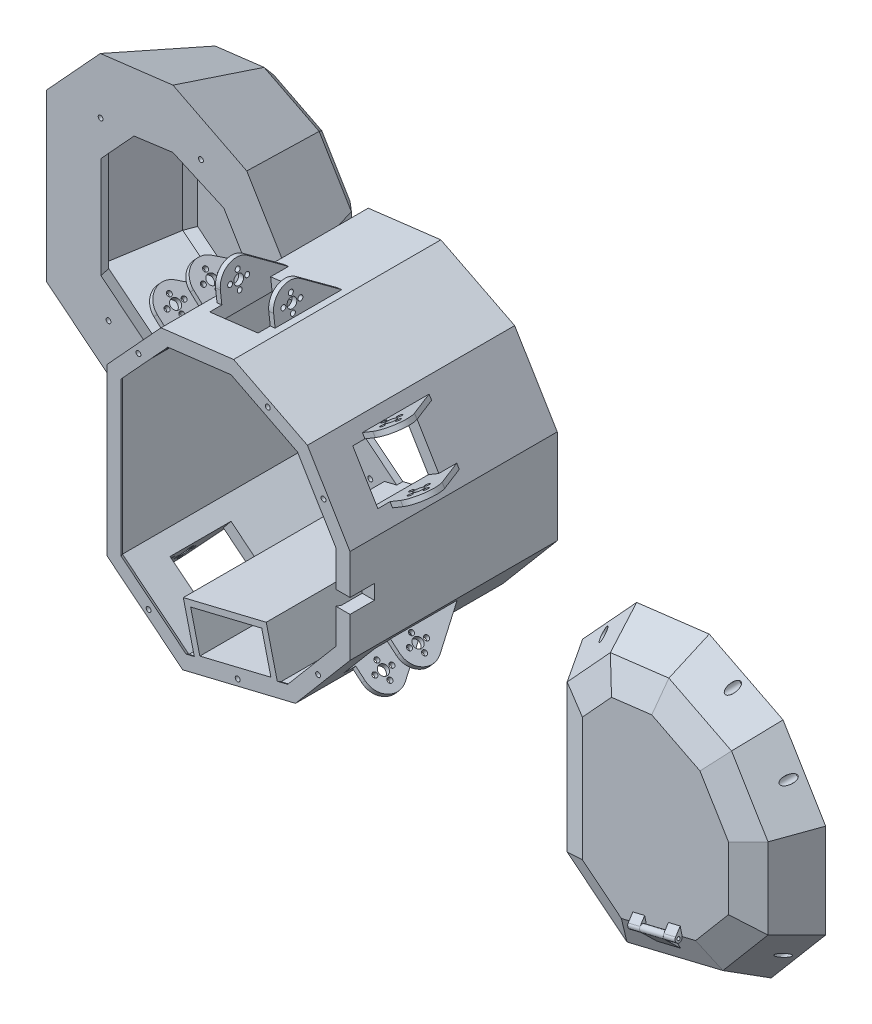
from build123d import *

# Parameters (mm, degrees)
SALIENTE_EXTRUIR1_DEPTH            = 30
SALIENTE_EXTRUIR1_TAPER            = 30
SALIENTE_EXTRUIR2_DEPTH            = 10
SALIENTE_EXTRUIR2_TAPER            = 66
SALIENTE_EXTRUIR3_DEPTH            = 170
SALIENTE_EXTRUIR4_DEPTH            = 80
SALIENTE_EXTRUIR4_TAPER            = 20
SALIENTE_EXTRUIR5_DEPTH            = 10
SALIENTE_EXTRUIR5_TAPER            = 48
VACIADO5_T                         = 10
CROQUIS11_W                        = 4
CROQUIS11_H                        = 54.70402768
SALIENTE_EXTRUIR6_DEPTH            = 40
CROQUIS12_R                        = 4
CROQUIS12_R_2                      = 2
CORTAR_EXTRUIR2_DEPTH              = 50
CROQUIS13_W                        = 4
CROQUIS13_H                        = 54.7
SALIENTE_EXTRUIR7_DEPTH            = 40
CROQUIS14_R                        = 4
CROQUIS14_R_2                      = 2
CORTAR_EXTRUIR3_DEPTH              = 50
CROQUIS15_W                        = 4
CROQUIS15_H                        = 54.70402768
SALIENTE_EXTRUIR8_DEPTH            = 40
CROQUIS18_R                        = 4
CROQUIS18_R_2                      = 2
CORTAR_EXTRUIR4_DEPTH              = 50
CROQUIS19_W                        = 4
CROQUIS19_H                        = 54.70402768
SALIENTE_EXTRUIR9_DEPTH            = 40
CROQUIS20_R                        = 4
CROQUIS20_R_2                      = 2
CORTAR_EXTRUIR5_DEPTH              = 50
CROQUIS21_W                        = 4
CROQUIS21_H                        = 54.70402768
SALIENTE_EXTRUIR10_DEPTH           = 40
CROQUIS22_R                        = 4
CROQUIS22_R_2                      = 2
CORTAR_EXTRUIR6_DEPTH              = 50
CROQUIS23_W                        = 40
CROQUIS23_H                        = 50
CORTAR_EXTRUIR8_DEPTH              = 10
CROQUIS24_W                        = 40
CROQUIS24_H                        = 50
CORTAR_EXTRUIR9_DEPTH              = 10
CROQUIS25_W                        = 40
CROQUIS25_H                        = 50
CORTAR_EXTRUIR10_DEPTH             = 10
CROQUIS26_W                        = 40
CROQUIS26_H                        = 50
CORTAR_EXTRUIR11_DEPTH             = 10
CROQUIS27_W                        = 40
CROQUIS27_H                        = 50
CORTAR_EXTRUIR12_DEPTH             = 10
CROQUIS28_R                        = 2
CORTAR_EXTRUIR13_DEPTH             = 10
CROQUIS28_3_R                      = 3
CORTAR_EXTRUIR14_DEPTH             = 15
PARTIR3_SURFACE_1_BACK             = 467.561
PARTIR3_SURFACE_1_DEPTH            = 935.122
PARTIR3_SURFACE_2_BACK             = 467.561
PARTIR3_SURFACE_2_DEPTH            = 935.122
SALIENTE_EXTRUIR11_DEPTH           = 5
SALIENTE_EXTRUIR11_OTHER_WAY_DEPTH = 10
SALIENTE_EXTRUIR11_OTHER_WAY_TAPER = 20
CROQUIS30_R                        = 2
CORTAR_EXTRUIR15_DEPTH             = 15
CROQUIS31_W                        = 12
CROQUIS31_H                        = 20
CORTAR_EXTRUIR16_DEPTH             = 15
CROQUIS40_W                        = 70
CROQUIS40_H                        = 170
SALIENTE_EXTRUIR14_DEPTH           = 40
CORTAR_EXTRUIR18_DEPTH             = 165
SALIENTE_EXTRUIR16_DEPTH           = 5
SALIENTE_EXTRUIR17_START           = -10
SALIENTE_EXTRUIR17_OUTLINE_R       = 1.25
SALIENTE_EXTRUIR17_DEPTH           = 20
SALIENTE_EXTRUIR18_START           = 10
CROQUIS51_3_R                      = 2.75
CROQUIS51_3_R_2                    = 1.25
SALIENTE_EXTRUIR18_DEPTH           = 10


# Read off the part's stored shape, not the designer's step: Saliente-Extruir17
with BuildPart() as part:
    # Croquis1 → Saliente-Extruir1 (new body)
    with BuildSketch(Plane(origin=(0, 0, 0), x_dir=(0, 1, 0), z_dir=(0, 0, 1))):
        Polygon((-68.404999243, 107.526749938), (-118.347734244, 45.396375895), (-95.921917701, -47.140641889), (-43.036623179, -91.84289375), (34.322441325, -91.84289375), (92.312520813, -56.905794058), (122.98573872, 3.65316538), (115.706819689, 63.210006613), (67.462083044, 107.526749938), align=None)
    extrude(amount=SALIENTE_EXTRUIR1_DEPTH, taper=SALIENTE_EXTRUIR1_TAPER)

    # Croquis2 → Saliente-Extruir2 (add)
    with BuildSketch(Plane.XY.offset(30)):
        Polygon((-90.206241862, -60.105218731), (-41.189858589, -99.50643397), (37.564034231, -80.420878862), (74.522385675, -36.697056913), (74.522385675, 29.508038933), (44.638667534, 79.110301447), (-6.780395449, 105.154145959), (-54.772569618, 99.288637603), (-90.206241862, 60.71431879), align=None)
    extrude(amount=SALIENTE_EXTRUIR2_DEPTH, taper=SALIENTE_EXTRUIR2_TAPER)

    # Croquis3 → Saliente-Extruir3 (add)
    with BuildSketch(Plane(origin=(0, 0, 0), x_dir=(1, 0, 0), z_dir=(0, 0, -1))):
        Polygon((-45.396375895, 118.347734244), (-107.526749938, 68.404999243), (-107.526749938, -67.462083044), (-63.210006613, -115.706819689), (-3.65316538, -122.98573872), (56.905794058, -92.312520813), (91.84289375, -34.322441325), (91.84289375, 43.036623179), (47.140641889, 95.921917701), align=None)
    extrude(amount=SALIENTE_EXTRUIR3_DEPTH)

    # Croquis4 → Saliente-Extruir4 (add)
    with BuildSketch(Plane(origin=(0, 0, -170), x_dir=(1, 0, 0), z_dir=(0, 0, -1))):
        Polygon((47.140641889, 95.921917701), (-45.396375895, 118.347734244), (-107.526749938, 68.404999243), (-107.526749938, -67.462083044), (-63.210006613, -115.706819689), (-3.65316538, -122.98573872), (56.905794058, -92.312520813), (91.84289375, -34.322441325), (91.84289375, 43.036623179), align=None)
    extrude(amount=SALIENTE_EXTRUIR4_DEPTH, taper=SALIENTE_EXTRUIR4_TAPER)

    # Croquis5 → Saliente-Extruir5 (add)
    with BuildSketch(Plane(origin=(0, 0, -250), x_dir=(1, 0, 0), z_dir=(0, 0, -1))):
        Polygon((62.725275009, 32.37913711), (31.041344489, 69.863020524), (-38.324772302, 86.673501851), (-78.409131197, 54.452184261), (-78.409131197, -56.118372683), (-49.025776422, -88.106107036), (-8.910372182, -93.008932192), (36.2834479, -70.118183997), (62.725275009, -26.228918162), align=None)
    extrude(amount=SALIENTE_EXTRUIR5_DEPTH, taper=SALIENTE_EXTRUIR5_TAPER)

    # Vaciado5 (no face opened: a closed hollow body)
    add(offset(amount=-VACIADO5_T, mode=Mode.PRIVATE), mode=Mode.SUBTRACT)

    # Croquis11 → Saliente-Extruir6 (add)
    with BuildSketch(Plane(origin=(-91.928010464, 84.44340932, 0), x_dir=(-0.676490722691871, -0.7364511539211749, 0), z_dir=(-0.7364511539211749, 0.676490722691871, 0))):
        with Locations((-31.696558975, -67.35201384)):
            Rectangle(CROQUIS11_W, CROQUIS11_H)
        with Locations((12.303441025, -67.35201384)):
            Rectangle(CROQUIS11_W, CROQUIS11_H)
    extrude(amount=SALIENTE_EXTRUIR6_DEPTH)

    # Croquis12 → Cortar-Extruir2 (cut)
    with BuildSketch(Plane(origin=(22.795409533, 24.815869741, 0), x_dir=(-0.7364511539211749, 0.676490722691871, 0), z_dir=(0.676490722691871, 0.7364511539211749, 0))):
        with Locations((134.825672382, -55)):
            Circle(CROQUIS12_R)
        with Locations((141.825672382, -55)):
            Circle(CROQUIS12_R_2)
        with Locations((134.825672382, -62)):
            Circle(CROQUIS12_R_2)
        with Locations((127.825672382, -55)):
            Circle(CROQUIS12_R_2)
        with Locations((134.825672382, -48)):
            Circle(CROQUIS12_R_2)
        with BuildLine():
            Line((124.825672382, -94.70402768), (147.017969868, -63.737727509))
            ThreePointArc((147.017969868, -63.737727509), (148.168571479, -48.146749407), (134.825672382, -40))
            Line((134.825672382, -40), (164.945824862, -1.18926273))
            Line((164.945824862, -1.18926273), (173.837004067, -6.387014225))
            Line((173.837004067, -6.387014225), (164.825672382, -94.70402768))
            Line((164.825672382, -94.70402768), (124.825672382, -94.70402768))
        make_face()
    extrude(amount=-CORTAR_EXTRUIR2_DEPTH, mode=Mode.SUBTRACT)

    # Croquis13 → Saliente-Extruir7 (add)
    with BuildSketch(Plane(origin=(-14.863619809, 121.615619211, 0), x_dir=(-0.9926140205620685, -0.12131531718462249, 0), z_dir=(-0.12131531718462249, 0.9926140205620685, 0))):
        with Locations((-3.293870727, -67.35)):
            Rectangle(CROQUIS13_W, CROQUIS13_H)
        with Locations((40.706129273, -67.35)):
            Rectangle(CROQUIS13_W, CROQUIS13_H)
    extrude(amount=SALIENTE_EXTRUIR7_DEPTH)

    # Croquis14 → Cortar-Extruir3 (cut)
    with BuildSketch(Plane(origin=(5.254770306, 0.642227606, 0), x_dir=(-0.12131531718462255, 0.9926140205620686, 0), z_dir=(0.9926140205620686, 0.12131531718462255, 0))):
        with Locations((132.5205535, -55)):
            Circle(CROQUIS14_R)
        with Locations((132.5205535, -48)):
            Circle(CROQUIS14_R_2)
        with Locations((139.5205535, -55)):
            Circle(CROQUIS14_R_2)
        with Locations((132.5205535, -62)):
            Circle(CROQUIS14_R_2)
        with Locations((125.5205535, -55)):
            Circle(CROQUIS14_R_2)
        with BuildLine():
            Line((122.5205535, -94.7), (144.712312806, -63.738478415))
            ThreePointArc((144.712312806, -63.738478415), (145.863663636, -48.147160305), (132.5205535, -40))
            Line((132.5205535, -40), (156.981323368, -5.368634874))
            Line((156.981323368, -5.368634874), (189.618535001, -23.570885668))
            Line((189.618535001, -23.570885668), (165.331077015, -94.7))
            Line((165.331077015, -94.7), (122.5205535, -94.7))
        make_face()
    extrude(amount=-CORTAR_EXTRUIR3_DEPTH, mode=Mode.SUBTRACT)

    # Croquis15 → Saliente-Extruir8 (add)
    with BuildSketch(Plane(origin=(82.555986417, 49.737243905, 0), x_dir=(-0.5160485808412013, 0.8565593162249665, 0), z_dir=(0.8565593162249665, 0.5160485808412013, 0))):
        with Locations((-6.145596333, -67.35201384)):
            Rectangle(CROQUIS15_W, CROQUIS15_H)
        with Locations((37.854403667, -67.35201384)):
            Rectangle(CROQUIS15_W, CROQUIS15_H)
    extrude(amount=SALIENTE_EXTRUIR8_DEPTH)

    # Croquis18 → Cortar-Extruir4 (cut)
    with BuildSketch(Plane(origin=(4.203523428, -6.977186425, 0), x_dir=(0.8565593162249665, 0.5160485808412013, 0), z_dir=(0.5160485808412013, -0.8565593162249665, 0))):
        with Locations((106.380933408, -55)):
            Circle(CROQUIS18_R)
        with Locations((106.380933408, -48)):
            Circle(CROQUIS18_R_2)
        with Locations((113.380933408, -55)):
            Circle(CROQUIS18_R_2)
        with Locations((106.380933408, -62)):
            Circle(CROQUIS18_R_2)
        with Locations((99.380933408, -55)):
            Circle(CROQUIS18_R_2)
        with BuildLine():
            Line((96.380933408, -94.70402768), (118.573230893, -63.737727509))
            ThreePointArc((118.573230893, -63.737727509), (119.723832505, -48.146749407), (106.380933408, -40))
            Line((106.380933408, -40), (134.708061578, -5.869404832))
            Line((134.708061578, -5.869404832), (160.9211633, -21.571733922))
            Line((160.9211633, -21.571733922), (143.734603356, -94.70402768))
            Line((143.734603356, -94.70402768), (96.380933408, -94.70402768))
        make_face()
    extrude(amount=-CORTAR_EXTRUIR4_DEPTH, mode=Mode.SUBTRACT)

    # Croquis19 → Saliente-Extruir9 (add)
    with BuildSketch(Plane(origin=(74.78682567, -63.214917252, 0), x_dir=(0.6455479366889291, 0.7637197532057597, 0), z_dir=(0.7637197532057597, -0.6455479366889291, 0))):
        with Locations((-30.202423941, -67.35201384)):
            Rectangle(CROQUIS19_W, CROQUIS19_H)
        with Locations((13.797576059, -67.35201384)):
            Rectangle(CROQUIS19_W, CROQUIS19_H)
    extrude(amount=SALIENTE_EXTRUIR9_DEPTH)

    # Croquis20 → Cortar-Extruir5 (cut)
    with BuildSketch(Plane(origin=(-20.788208331, -24.593627264, 0), x_dir=(0.7637197532057597, -0.645547936688929, 0), z_dir=(-0.645547936688929, -0.7637197532057597, 0))):
        with Locations((107.924435444, -55)):
            Circle(CROQUIS20_R)
        with Locations((107.924435444, -48)):
            Circle(CROQUIS20_R_2)
        with Locations((114.924435444, -55)):
            Circle(CROQUIS20_R_2)
        with Locations((107.924435444, -62)):
            Circle(CROQUIS20_R_2)
        with Locations((100.924435444, -55)):
            Circle(CROQUIS20_R_2)
        with BuildLine():
            Line((97.924435444, -94.70402768), (120.11673293, -63.737727509))
            ThreePointArc((120.11673293, -63.737727509), (121.267334541, -48.146749407), (107.924435444, -40))
            Line((107.924435444, -40), (137.968823498, -8.626915468))
            Line((137.968823498, -8.626915468), (166.338745199, -32.579485082))
            Line((166.338745199, -32.579485082), (145.364960685, -94.70402768))
            Line((145.364960685, -94.70402768), (97.924435444, -94.70402768))
        make_face()
    extrude(amount=-CORTAR_EXTRUIR5_DEPTH, mode=Mode.SUBTRACT)

    # Croquis21 → Saliente-Extruir10 (add)
    with BuildSketch(Plane(origin=(-75.609807157, -94.061040107, 0), x_dir=(0.7794076024949522, -0.6265171898464325, 0), z_dir=(-0.6265171898464325, -0.7794076024949522, 0))):
        with Locations((-23.092824546, -67.35201384)):
            Rectangle(CROQUIS21_W, CROQUIS21_H)
        with Locations((20.907175454, -67.35201384)):
            Rectangle(CROQUIS21_W, CROQUIS21_H)
    extrude(amount=SALIENTE_EXTRUIR10_DEPTH)

    # Croquis22 → Cortar-Extruir6 (cut)
    with BuildSketch(Plane(origin=(-19.557538219, 15.72108592, 0), x_dir=(-0.6265171898464322, -0.7794076024949523, 0), z_dir=(-0.7794076024949523, 0.6265171898464322, 0))):
        with Locations((130.682733663, -55)):
            Circle(CROQUIS22_R)
        with Locations((130.682733663, -48)):
            Circle(CROQUIS22_R_2)
        with Locations((137.682733663, -55)):
            Circle(CROQUIS22_R_2)
        with Locations((130.682733663, -62)):
            Circle(CROQUIS22_R_2)
        with Locations((123.682733663, -55)):
            Circle(CROQUIS22_R_2)
        with BuildLine():
            Line((120.682733663, -94.70402768), (142.875031149, -63.737727509))
            ThreePointArc((142.875031149, -63.737727509), (144.02563276, -48.146749407), (130.682733663, -40))
            Line((130.682733663, -40), (155.208064132, -5.904154912))
            Line((155.208064132, -5.904154912), (193.900860848, -26.783087829))
            Line((193.900860848, -26.783087829), (171.143323285, -94.70402768))
            Line((171.143323285, -94.70402768), (120.682733663, -94.70402768))
        make_face()
    extrude(amount=-CORTAR_EXTRUIR6_DEPTH, mode=Mode.SUBTRACT)

    # Croquis23 → Cortar-Extruir8 (cut)
    with BuildSketch(Plane(origin=(-75.609807157, -94.061040107, 0), x_dir=(0.7794076024949522, -0.6265171898464325, 0), z_dir=(-0.6265171898464325, -0.7794076024949522, 0))):
        with Locations((-1.092824546, -55)):
            Rectangle(CROQUIS23_W, CROQUIS23_H)
    extrude(amount=-CORTAR_EXTRUIR8_DEPTH, mode=Mode.SUBTRACT)

    # Croquis24 → Cortar-Extruir9 (cut)
    with BuildSketch(Plane(origin=(74.78682567, -63.214917252, 0), x_dir=(0.6455479366889291, 0.7637197532057597, 0), z_dir=(0.7637197532057597, -0.6455479366889291, 0))):
        with Locations((-8.202423941, -55)):
            Rectangle(CROQUIS24_W, CROQUIS24_H)
    extrude(amount=-CORTAR_EXTRUIR9_DEPTH, mode=Mode.SUBTRACT)

    # Croquis25 → Cortar-Extruir10 (cut)
    with BuildSketch(Plane(origin=(82.555986417, 49.737243905, 0), x_dir=(-0.5160485808412013, 0.8565593162249665, 0), z_dir=(0.8565593162249665, 0.5160485808412013, 0))):
        with Locations((15.854403667, -55)):
            Rectangle(CROQUIS25_W, CROQUIS25_H)
    extrude(amount=-CORTAR_EXTRUIR10_DEPTH, mode=Mode.SUBTRACT)

    # Croquis26 → Cortar-Extruir11 (cut)
    with BuildSketch(Plane(origin=(-14.863619809, 121.615619211, 0), x_dir=(-0.9926140205620685, -0.12131531718462249, 0), z_dir=(-0.12131531718462249, 0.9926140205620685, 0))):
        with Locations((18.706129273, -55)):
            Rectangle(CROQUIS26_W, CROQUIS26_H)
    extrude(amount=-CORTAR_EXTRUIR11_DEPTH, mode=Mode.SUBTRACT)

    # Croquis27 → Cortar-Extruir12 (cut)
    with BuildSketch(Plane(origin=(-91.928010464, 84.44340932, 0), x_dir=(-0.676490722691871, -0.7364511539211749, 0), z_dir=(-0.7364511539211749, 0.676490722691871, 0))):
        with Locations((-9.696558975, -55)):
            Rectangle(CROQUIS27_W, CROQUIS27_H)
    extrude(amount=-CORTAR_EXTRUIR12_DEPTH, mode=Mode.SUBTRACT)

    # Croquis28 → Cortar-Extruir13 (cut)
    with BuildSketch(Plane(origin=(0, 0, 0), x_dir=(0, 1, 0), z_dir=(0, 0, 1))):
        with Locations(Location((-66.251530756, -65.673169054, 0), (0, 0, 270))):
            Circle(CROQUIS28_R)
        with Locations(Location((60.737238165, -70.091547323, 0), (0, 0, 270))):
            Circle(CROQUIS28_R)
        with Locations(Location((-102.275486484, 0.305500111, 0), (0, 0, 270))):
            Circle(CROQUIS28_R)
        with Locations(Location((-89.479328731, 73.328976967, 0), (0, 0, 270))):
            Circle(CROQUIS28_R)
        with Locations(Location((103.188654321, -24.367075796, 0), (0, 0, 270))):
            Circle(CROQUIS28_R)
        with Locations(Location((88.201997753, 81.686122506, 0), (0, 0, 270))):
            Circle(CROQUIS28_R)
    extrude(amount=-CORTAR_EXTRUIR13_DEPTH, mode=Mode.SUBTRACT)

    # Croquis28<3> → Cortar-Extruir14 (cut)
    with BuildSketch(Plane(origin=(0, 0, 0), x_dir=(0, 1, 0), z_dir=(0, 0, 1))):
        with Locations(Location((-102.275486484, 0.305500111, 0), (0, 0, 193.622667342))):
            Circle(CROQUIS28_3_R)
        with Locations(Location((88.201997753, 81.686122506, 0), (0, 0, 47.429979359))):
            Circle(CROQUIS28_3_R)
        with Locations(Location((103.188654321, -24.367075796, 0), (0, 0, 333.137707041))):
            Circle(CROQUIS28_3_R)
        with Locations(Location((60.737238165, -70.091547323, 0), (0, 0, 301.067569375))):
            Circle(CROQUIS28_3_R)
        with Locations(Location((-66.251530756, -65.673169054, 0), (0, 0, 229.793229681))):
            Circle(CROQUIS28_3_R)
        with Locations(Location((-89.479328731, 73.328976967, 0), (0, 0, 141.206368002))):
            Circle(CROQUIS28_3_R)
    extrude(amount=CORTAR_EXTRUIR14_DEPTH, mode=Mode.SUBTRACT)


with BuildPart() as body_2:
    # Partir1: the piece on the far side of the plane
    add(part.part)
    split(bisect_by=Plane.XY, keep=Keep.BOTTOM)

    # Croquis29 → Saliente-Extruir11 (add)
    with BuildSketch(Plane(origin=(0, 0, -170), x_dir=(0, 1, 0), z_dir=(0, 0, 1))):
        Polygon((-118.347734244, 45.396375895), (-95.921917701, -47.140641889), (-43.036623179, -91.84289375), (34.322441325, -91.84289375), (92.312520813, -56.905794058), (122.98573872, 3.65316538), (115.706819689, 63.210006613), (67.462083044, 107.526749938), (-68.404999243, 107.526749938), align=None)
        Polygon((56.552163909, -38.015372281), (75.161525593, 3.723486513), (70.883895, 35.569536763), (41.328378256, 62.71870039), (-41.906024181, 62.71870039), (-72.501762559, 24.656614493), (-58.763339626, -32.033079942), (-26.364941036, -59.41841242), (21.026490345, -59.41841242), align=None, mode=Mode.SUBTRACT)
    extrude(amount=SALIENTE_EXTRUIR11_DEPTH)

    # Croquis29 → Saliente-Extruir11 other way (add)
    with BuildSketch(Plane(origin=(0, 0, -170), x_dir=(0, 1, 0), z_dir=(0, 0, 1))):
        Polygon((-118.347734244, 45.396375895), (-95.921917701, -47.140641889), (-43.036623179, -91.84289375), (34.322441325, -91.84289375), (92.312520813, -56.905794058), (122.98573872, 3.65316538), (115.706819689, 63.210006613), (67.462083044, 107.526749938), (-68.404999243, 107.526749938), align=None)
        Polygon((56.552163909, -38.015372281), (75.161525593, 3.723486513), (70.883895, 35.569536763), (41.328378256, 62.71870039), (-41.906024181, 62.71870039), (-72.501762559, 24.656614493), (-58.763339626, -32.033079942), (-26.364941036, -59.41841242), (21.026490345, -59.41841242), align=None, mode=Mode.SUBTRACT)
    extrude(amount=-SALIENTE_EXTRUIR11_OTHER_WAY_DEPTH, taper=SALIENTE_EXTRUIR11_OTHER_WAY_TAPER)

    # Croquis30 → Cortar-Extruir15 (cut)
    with BuildSketch(Plane.XY.offset(-165)):
        with Locations((-62.963257581, 69.984302941)):
            Circle(CROQUIS30_R)
        with Locations((-56.486772615, -70.766616592)):
            Circle(CROQUIS30_R)
        with Locations((19.320402513, 81.580685238)):
            Circle(CROQUIS30_R)
        with Locations((53.125904378, -52.381604535)):
            Circle(CROQUIS30_R)
    extrude(amount=-CORTAR_EXTRUIR15_DEPTH, mode=Mode.SUBTRACT)


with BuildPart() as part_1:
    add(part.part)

    # Partir1
    split(bisect_by=Plane.XY, keep=Keep.TOP)


with BuildPart() as body_3:
    # Partir3: the piece behind the surface
    add(part_1.part)
    # Partir3 surface: a surface, the sketch's curves swept straight by 935.122 mm
    with BuildLine(Plane.XY.offset(40).offset(-PARTIR3_SURFACE_1_BACK), mode=Mode.PRIVATE) as partir3_surface_1_path:
        Line((-45.396375895, -118.347734244), (-35.735057541, -75.073979046))
        Line((-35.735057541, -75.073979046), (25.145568863, -60.319907741))
        Line((25.145568863, -60.319907741), (47.140641889, -95.921917701))
    partir3_surface_1 = Shell.extrude(partir3_surface_1_path.wire(), (0 * PARTIR3_SURFACE_1_DEPTH, 0 * PARTIR3_SURFACE_1_DEPTH, 1 * PARTIR3_SURFACE_1_DEPTH))
    split(bisect_by=partir3_surface_1, keep=Keep.BOTTOM)


with BuildPart() as part_2:
    add(part_1.part)

    # Partir3: split by a surface, the side it looks to stays
    # Partir3 surface: a surface, the sketch's curves swept straight by 935.122 mm
    with BuildLine(Plane.XY.offset(40).offset(-PARTIR3_SURFACE_2_BACK), mode=Mode.PRIVATE) as partir3_surface_2_path:
        Line((-45.396375895, -118.347734244), (-35.735057541, -75.073979046))
        Line((-35.735057541, -75.073979046), (25.145568863, -60.319907741))
        Line((25.145568863, -60.319907741), (47.140641889, -95.921917701))
    partir3_surface_2 = Shell.extrude(partir3_surface_2_path.wire(), (0 * PARTIR3_SURFACE_2_DEPTH, 0 * PARTIR3_SURFACE_2_DEPTH, 1 * PARTIR3_SURFACE_2_DEPTH))
    split(bisect_by=partir3_surface_2, keep=Keep.TOP)


with BuildPart() as body_4:
    # Partir2: the piece on the far side of the plane
    add(body_2.part)
    split(bisect_by=Plane.XY.offset(-170), keep=Keep.BOTTOM)


with BuildPart() as body_2_1:
    add(body_2.part)

    # Partir2
    split(bisect_by=Plane.XY.offset(-170), keep=Keep.TOP)

    # Croquis31 → Cortar-Extruir16 (cut)
    with BuildSketch(Plane.YZ.offset(91.84289375)):
        with Locations((-4.357090927, -10)):
            Rectangle(CROQUIS31_W, CROQUIS31_H)
    extrude(amount=-CORTAR_EXTRUIR16_DEPTH, mode=Mode.SUBTRACT)

    # Croquis40 → Saliente-Extruir14 (add)
    with BuildSketch(Plane(origin=(22.216356803, -91.672711253, 0), x_dir=(-0.9718678976535764, -0.23552662165967087, 0), z_dir=(-0.23552662165967087, 0.9718678976535764, 0))):
        with Locations((24.385505561, -85)):
            Rectangle(CROQUIS40_W, CROQUIS40_H)
    extrude(amount=SALIENTE_EXTRUIR14_DEPTH)

    # Croquis41 → Cortar-Extruir18 (cut)
    with BuildSketch(Plane.XY):
        Polygon((-38.882601907, -70.466569228), (19.429471952, -56.334971928), (26.966323845, -87.434744653), (-31.345750014, -101.566341952), align=None)
    extrude(amount=-CORTAR_EXTRUIR18_DEPTH, mode=Mode.SUBTRACT)

    # Croquis43 → Saliente-Extruir16 (add)
    with BuildSketch(Plane.XY.offset(-165)):
        Polygon((-44.919574504, -66.784862848), (23.111178332, -50.297999331), (26.463811786, -64.132175712), (-42.240420441, -77.840020045), align=None)
    extrude(amount=-SALIENTE_EXTRUIR16_DEPTH)


with BuildPart() as body_4_1:
    # Sólido-Mover/Copiar3: moved
    add(body_4.part.moved(Location((-219.746064596, 0, 0))))


with BuildPart() as part_3:
    # Sólido-Mover/Copiar4: moved
    add(part_2.part.moved(Location((390.178766484, 0, 0))))

    # Croquis51<3> → Saliente-Extruir18 (add)
    # profile 1 of 2: a face of its own
    with BuildSketch(Plane(origin=(348.037549828, 84.344907903, 0), x_dir=(-0.23552662165967037, 0.9718678976535765, 0), z_dir=(0.9718678976535765, 0.23552662165967037, 0)).offset(SALIENTE_EXTRUIR18_START)):
        with BuildLine():
            Line((-156.44291952, 40), (-149.553832224, 40))
            Line((-149.553832224, 40), (-154.498375872, 44.944543648))
            ThreePointArc((-154.498375872, 44.944543648), (-153.902250806, 44.052379439), (-153.69291952, 43))
            ThreePointArc((-153.69291952, 43), (-154.498375872, 41.055456352), (-156.44291952, 40.25))
            Line((-156.44291952, 40.25), (-156.44291952, 40))
        make_face()
    # profile 2 of 2: a face of its own
    with BuildSketch(Plane(origin=(348.037549828, 84.344907903, 0), x_dir=(-0.23552662165967037, 0.9718678976535765, 0), z_dir=(0.9718678976535765, 0.23552662165967037, 0)).offset(SALIENTE_EXTRUIR18_START)):
        with Locations((-156.44291952, 43)):
            Circle(CROQUIS51_3_R)
        with Locations((-156.44291952, 43)):
            Circle(CROQUIS51_3_R_2, mode=Mode.SUBTRACT)
    saliente_extruir18 = extrude(amount=SALIENTE_EXTRUIR18_DEPTH)

    # Simetría1: Saliente-Extruir18 across plane
    add(saliente_extruir18.mirror(Plane(origin=(348.037549828, 84.344907903, 0), x_dir=(0, 0, 1), z_dir=(0.9718678976535765, 0.23552662165967037, 0))))


with BuildPart() as body_3_1:
    # Sólido-Mover/Copiar4: moved
    add(body_3.part.moved(Location((390.178766484, 0, 0))))

    # Saliente-Extruir17 outline → Saliente-Extruir17 (add)
    with BuildSketch(Plane(origin=(348.037549828, 84.344907903, 0), x_dir=(-0.23552662165967037, 0.9718678976535765, 0), z_dir=(0.9718678976535765, 0.23552662165967037, 0)).offset(SALIENTE_EXTRUIR17_START)):
        with BuildLine():
            Line((-158.387463168, 44.944543648), (-168.860806159, 34.471200657))
            Line((-168.860806159, 34.471200657), (-156.44291952, 40))
            Line((-156.44291952, 40), (-156.44291952, 40.25))
            ThreePointArc((-156.44291952, 40.25), (-153.902250806, 44.052379439), (-158.387463168, 44.944543648))
        make_face()
        with Locations((-156.44291952, 43)):
            Circle(SALIENTE_EXTRUIR17_OUTLINE_R, mode=Mode.SUBTRACT)
    extrude(amount=SALIENTE_EXTRUIR17_DEPTH)


solid = Compound([body_2_1.part, body_4_1.part, part_3.part, body_3_1.part])
